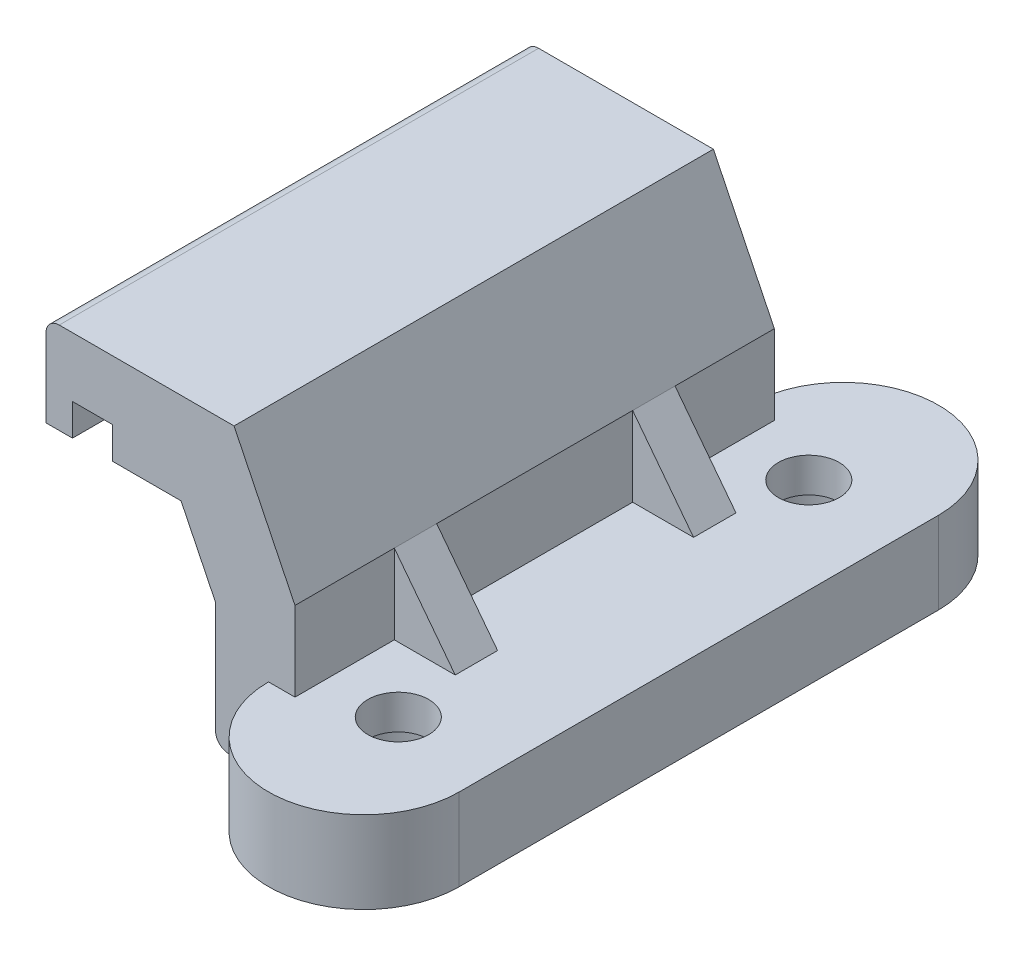
from build123d import *

# Parameters (mm, degrees)
EXTRUSION1_DEPTH                                  = 18.1
COQUE1_START                                      = 1
COQUE1_DEPTH                                      = 16.1
EXTRUSION2_DEPTH                                  = 3.1
ESQUISSE3_W                                       = 6.2
ESQUISSE3_H                                       = 18.1
EXTRUSION3_DEPTH                                  = 2.1
CHAMBRAGE_POUR_VIS_T_TE_HEXAGONALE_M2_D           = 2.3
CHAMBRAGE_POUR_VIS_T_TE_HEXAGONALE_M2_CBORE_D     = 4.5
CHAMBRAGE_POUR_VIS_T_TE_HEXAGONALE_M2_CBORE_DEPTH = 1.8
ENL_V_MAT_EXTRU_1_DEPTH                           = 1.6
EXTRUSION4_DEPTH                                  = 1.6
R_P_TITION_LIN_AIRE1_COUNT                        = 2
R_P_TITION_LIN_AIRE1_PITCH                        = 9


# Read off the part's stored shape, not the designer's step: Coque1
with BuildPart() as part:
    # Esquisse1 → Extrusion1 (new body)
    with BuildSketch(Plane.XY):
        with BuildLine():
            Line((0.5, 0), (9.2, 0))
            Line((9.2, 0), (9.2, 3.1))
            Line((9.2, 3.1), (3, 3.1))
            Line((3, 3.1), (3, 6.1))
            Line((3, 6.1), (0.698275932, 10.81853434))
            Line((0.698275932, 10.81853434), (-5.901724068, 10.81853434))
            ThreePointArc((-5.901724068, 10.81853434), (-6.255277459, 10.67208773), (-6.401724068, 10.31853434))
            Line((-6.401724068, 10.31853434), (-6.401724068, 7.36853434))
            Line((-6.401724068, 7.36853434), (-5.401724068, 7.36853434))
            Line((-5.401724068, 7.36853434), (-5.401724068, 8.56853434))
            Line((-5.401724068, 8.56853434), (-3.884726415, 8.56853434))
            Line((-3.884726415, 8.56853434), (-3.884726415, 7.36853434))
            Line((-3.884726415, 7.36853434), (-1.301724068, 7.36853434))
            Line((-1.301724068, 7.36853434), (0, 4.7))
            Line((0, 4.7), (0, 0.5))
            ThreePointArc((0, 0.5), (0.146446609, 0.146446609), (0.5, 0))
        make_face()
    extrude(amount=EXTRUSION1_DEPTH)

    # Coque1 outline → Coque1 (cut)
    with BuildSketch(Plane.XY.offset(COQUE1_START)):
        with BuildLine():
            Line((-5.401724068, 9.81853434), (-5.401724068, 9.56853434))
            Line((-5.401724068, 9.56853434), (-2.884726415, 9.56853434))
            Line((-2.884726415, 9.56853434), (-2.884726415, 7.36853434))
            Line((-2.884726415, 7.36853434), (-1.301724068, 7.36853434))
            Line((-1.301724068, 7.36853434), (0, 4.7))
            Line((0, 4.7), (0, 0.5))
            ThreePointArc((0, 0.5), (0.146446609, 0.146446609), (0.5, 0))
            Line((0.5, 0), (8.2, 0))
            Line((8.2, 0), (8.2, 2.1))
            Line((8.2, 2.1), (2, 2.1))
            Line((2, 2.1), (2, 5.869101054))
            Line((2, 5.869101054), (0.073447178, 9.81853434))
            Line((0.073447178, 9.81853434), (-5.401724068, 9.81853434))
        make_face()
    extrude(amount=COQUE1_DEPTH, mode=Mode.SUBTRACT)

    # Esquisse2 → Extrusion2 (add)
    with BuildSketch(Plane(origin=(0, 3.1, 0), x_dir=(-1, 0, 0), z_dir=(0, 1, 0))):
        with BuildLine():
            Line((-9.2, 0), (-2, 0))
            ThreePointArc((-2, 0), (-5.6, -3.6), (-9.2, 0))
        make_face()
        with BuildLine():
            Line((-9.2, 18.1), (-2, 18.1))
            ThreePointArc((-2, 18.1), (-5.6, 21.7), (-9.2, 18.1))
        make_face()
    extrude(amount=-EXTRUSION2_DEPTH)

    # Esquisse3 → Extrusion3 (add)
    with BuildSketch(Plane.XZ):
        with Locations((5.1, 9.05)):
            Rectangle(ESQUISSE3_W, ESQUISSE3_H)
    extrude(amount=-EXTRUSION3_DEPTH)

    # Chambrage pour vis à tête hexagonale M2.51 (through all)
    with Locations(Plane.XZ):
        with Locations((5.6, 1.3), (5.6, 16.8)):
            CounterBoreHole(CHAMBRAGE_POUR_VIS_T_TE_HEXAGONALE_M2_D / 2, CHAMBRAGE_POUR_VIS_T_TE_HEXAGONALE_M2_CBORE_D / 2, CHAMBRAGE_POUR_VIS_T_TE_HEXAGONALE_M2_CBORE_DEPTH)

    # Esquisse6 → Enlèv. mat.-Extru.1 (cut)
    with BuildSketch(Plane.XZ):
        with BuildLine():
            Line((3.75, 4.9), (7.45, 4.9))
            ThreePointArc((7.45, 4.9), (7.803553391, 5.046446609), (7.95, 5.4))
            Line((7.95, 5.4), (7.95, 12.7))
            ThreePointArc((7.95, 12.7), (7.803553391, 13.053553391), (7.45, 13.2))
            Line((7.45, 13.2), (3.75, 13.2))
            ThreePointArc((3.75, 13.2), (3.396446609, 13.053553391), (3.25, 12.7))
            Line((3.25, 12.7), (3.25, 5.4))
            ThreePointArc((3.25, 5.4), (3.396446609, 5.046446609), (3.75, 4.9))
        make_face()
    extrude(amount=-ENL_V_MAT_EXTRU_1_DEPTH, mode=Mode.SUBTRACT)

    # Esquisse7 → Extrusion4 (add)
    with BuildSketch(Plane.XY.offset(14.35)):
        Polygon((3, 6.1), (5.3, 3.1), (3, 3.1), align=None)
    extrusion4 = extrude(amount=-EXTRUSION4_DEPTH)

    # Répétition linéaire1: Extrusion4 ×2
    with Locations(*[(0, 0, -i * R_P_TITION_LIN_AIRE1_PITCH) for i in range(1, R_P_TITION_LIN_AIRE1_COUNT)]):
        add(extrusion4)


solid = part.part
